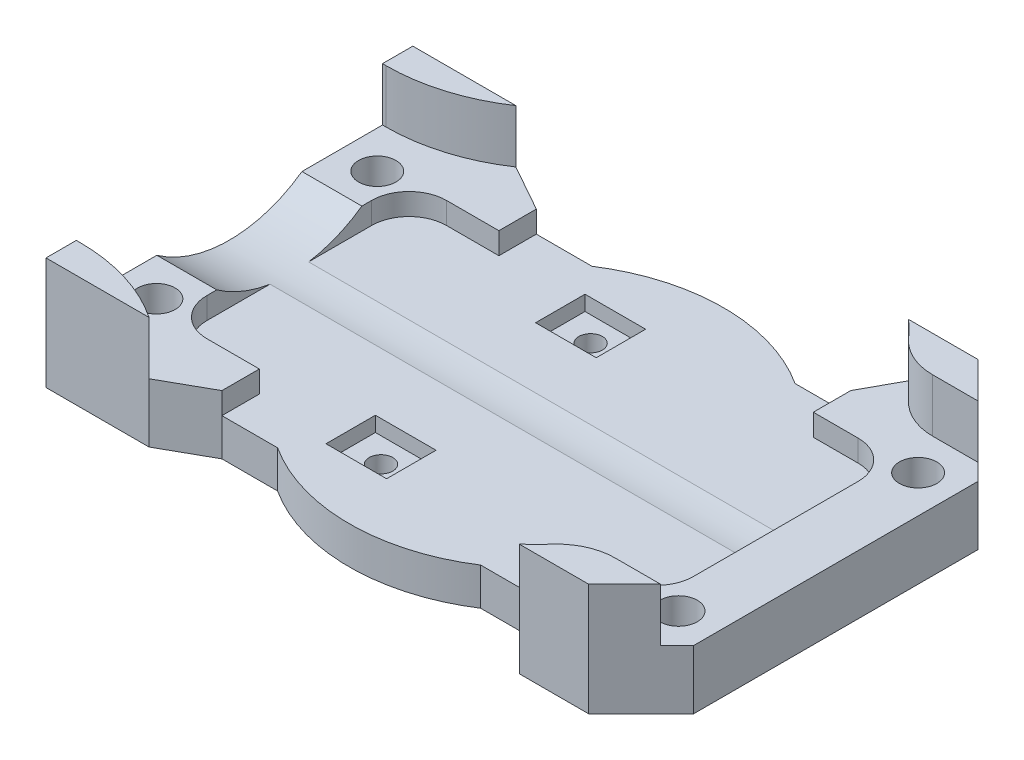
from build123d import *

# Parameters (mm, degrees)
SKETCH_1_R          = 25
SKETCH_1_W          = 81
SKETCH_1_H          = 42
SKETCH_1_R_2        = 2.5
EXTRUDE_1_DEPTH     = 5
SKETCH_3_W          = 8.1
SKETCH_3_H          = 6.6
SKETCH_3_R          = 1.575
CUT_EXTRUDE_1_DEPTH = 2
SKETCH_3_2_R        = 1.575
CUT_EXTRUDE_2_DEPTH = 49.280430818
SKETCH_4_W          = 8
SKETCH_4_H          = 2.9
EXTRUDE_2_DEPTH     = 42
SKETCH_1_3_R        = 2.5
CUT_EXTRUDE_3_DEPTH = 42
EXTRUDE_START       = 21
SKETCH_5_W          = 11
SKETCH_5_H          = 2.9
EXTRUDE_3_DEPTH     = 5
SKETCH_5_W_2        = 12
EXTRUDE_3_2_DEPTH   = 5
CUT_EXTRUDE_4_REACH = 87.138
CHAMFER_1_SIZE      = 2
EXTRUDE_4_DEPTH     = 15
EXTRUDE_4_2_DEPTH   = 15
EXTRUDE_START_2     = -15
EXTRUDE_5_DEPTH     = 7.9
EXTRUDE_6_DEPTH     = 15
EXTRUDE_7_DEPTH     = 7.9
FILLET_1_R          = 5


# Read off the part's stored shape, not the designer's step: 凸台-拉伸7
with BuildPart() as part:
    # 草图1 → 凸台-拉伸1 (new body)
    # profile 1 of 2: a face of its own
    with BuildSketch(Plane(origin=(0, 0, 0), x_dir=(1, 0, 0), z_dir=(0, 1, 0))):
        Circle(SKETCH_1_R)
    # profile 2 of 2: a face of its own
    with BuildSketch(Plane(origin=(0, 0, 0), x_dir=(1, 0, 0), z_dir=(0, 1, 0))):
        with Locations((-0.5, 0)):
            Rectangle(SKETCH_1_W, SKETCH_1_H)
        with Locations(Location((35, 16, 0), (0, 0, 270))):
            Circle(SKETCH_1_R_2, mode=Mode.SUBTRACT)
        with Locations(Location((35, -16, 0), (0, 0, 270))):
            Circle(SKETCH_1_R_2, mode=Mode.SUBTRACT)
        with Locations(Location((-36, 14.75, 0), (0, 0, 270))):
            Circle(SKETCH_1_R_2, mode=Mode.SUBTRACT)
        with Locations(Location((-36, -14.75, 0), (0, 0, 270))):
            Circle(SKETCH_1_R_2, mode=Mode.SUBTRACT)
    extrude(amount=EXTRUDE_1_DEPTH)

    # 草图3 → 切除-拉伸1 (cut)
    # profile 1 of 2: a face of its own
    with BuildSketch(Plane(origin=(0, 5, 0), x_dir=(1, 0, 0), z_dir=(0, 1, 0))):
        with Locations((-6.75, -14)):
            Rectangle(SKETCH_3_W, SKETCH_3_H)
        with Locations(Location((-6.75, -14, 0), (0, 0, 90))):
            Circle(SKETCH_3_R, mode=Mode.SUBTRACT)
    # profile 2 of 2: a face of its own
    with BuildSketch(Plane(origin=(0, 5, 0), x_dir=(1, 0, 0), z_dir=(0, 1, 0))):
        with Locations((-6.75, 14)):
            Rectangle(SKETCH_3_W, SKETCH_3_H)
        with Locations(Location((-6.75, 14, 0), (0, 0, 270))):
            Circle(SKETCH_3_R, mode=Mode.SUBTRACT)
    extrude(amount=-CUT_EXTRUDE_1_DEPTH, mode=Mode.SUBTRACT)

    # 草图3<2> → 切除-拉伸2 (cut, through all)
    with BuildSketch(Plane(origin=(0, 5, 0), x_dir=(1, 0, 0), z_dir=(0, 1, 0))):
        with Locations(Location((-6.75, 14, 0), (0, 0, 270))):
            Circle(SKETCH_3_2_R)
        with Locations(Location((-6.75, -14, 0), (0, 0, 270))):
            Circle(SKETCH_3_2_R)
    extrude(amount=-CUT_EXTRUDE_2_DEPTH, mode=Mode.SUBTRACT)

    # 草图4 → 凸台-拉伸2 (add)
    with BuildSketch(Plane.XY.offset(21)):
        with Locations((36, 6.45)):
            Rectangle(SKETCH_4_W, SKETCH_4_H)
        with Locations((-37, 6.45)):
            Rectangle(SKETCH_4_W, SKETCH_4_H)
    extrude(amount=-EXTRUDE_2_DEPTH)

    # 草图1<3> → 切除-拉伸3 (cut)
    with BuildSketch(Plane(origin=(0, 0, 0), x_dir=(1, 0, 0), z_dir=(0, 1, 0))):
        with Locations(Location((35, 16, 0), (0, 0, 270))):
            Circle(SKETCH_1_3_R)
        with Locations(Location((35, -16, 0), (0, 0, 270))):
            Circle(SKETCH_1_3_R)
        with Locations(Location((-36, 14.75, 0), (0, 0, 180))):
            Circle(SKETCH_1_3_R)
        with Locations(Location((-36, -14.75, 0), (0, 0, 180))):
            Circle(SKETCH_1_3_R)
    extrude(amount=CUT_EXTRUDE_3_DEPTH, mode=Mode.SUBTRACT)


with BuildPart() as body_2:
    # 草图5 → 凸台-拉伸3 (new body)
    with BuildSketch(Plane.XY.offset(EXTRUDE_START)):
        with Locations((26.5, 6.45)):
            Rectangle(SKETCH_5_W, SKETCH_5_H)
    extrude_3 = extrude(amount=-EXTRUDE_3_DEPTH)


with BuildPart() as body_3:
    # 草图5 → Extrude 3 2 (new body)
    with BuildSketch(Plane.XY.offset(EXTRUDE_START)):
        with Locations((-27, 6.45)):
            Rectangle(SKETCH_5_W_2, SKETCH_5_H)
    extrude_3_2 = extrude(amount=-EXTRUDE_3_2_DEPTH)



with BuildPart() as part_1:
    add(part.part)

    # 镜向2: 凸台-拉伸3, Extrude 3 2 across plane
    add(extrude_3.mirror(Plane(origin=(0, 0, 0), x_dir=(1, 0, 0), z_dir=(0, 0, -1))))
    add(extrude_3_2.mirror(Plane(origin=(0, 0, 0), x_dir=(1, 0, 0), z_dir=(0, 0, -1))))

    # 切除-拉伸4: up to this face of the body (flat: up to its plane)
    cut_extrude_4_end = Plane(part_1.part.faces().sort_by_distance((32, 6.45, 2.5))[0])
    # 草图6 → 切除-拉伸4 (cut, up to the picked face)
    with BuildSketch(Plane.ZY.offset(41), mode=Mode.PRIVATE) as cut_extrude_4_sk1:
        with BuildLine():
            Line((11.041960784, 8.971428571), (-11.041960784, 8.971428571))
            ThreePointArc((-11.041960784, 8.971428571), (-8.690257734, 7.239234925), (-6.072727273, 5.943265655))
            ThreePointArc((-6.072727273, 5.943265655), (0, 4.8), (6.072727273, 5.943265655))
            ThreePointArc((6.072727273, 5.943265655), (8.690257734, 7.239234925), (11.041960784, 8.971428571))
        make_face()
    cut_extrude_4_tool1 = split(extrude(cut_extrude_4_sk1.sketch, amount=-CUT_EXTRUDE_4_REACH, mode=Mode.PRIVATE), bisect_by=cut_extrude_4_end, keep=Keep.BOTH, mode=Mode.PRIVATE)
    add(cut_extrude_4_tool1.solids().sort_by(Axis((-41, 7.283597, 0), (1, 0, 0)))[0], mode=Mode.SUBTRACT)

    # 倒角1
    chamfer_1_edges = [part_1.edges().sort_by_distance(p)[0] for p in [
        (-41, 3.95, 21),
        (-41, 3.95, -21),
        (40, 3.95, -21),
        (40, 3.95, 21),
    ]]
    chamfer(chamfer_1_edges, length=CHAMFER_1_SIZE)



with BuildPart() as body_4:
    # 草图9 → 凸台-拉伸4 (new body)
    with BuildSketch(Plane.XZ):
        with BuildLine():
            Line((33, 26), (23.72846392, 26))
            ThreePointArc((23.72846392, 26), (24.88485791, 24.895458357), (25.989891949, 23.739534884))
            ThreePointArc((25.989891949, 23.739534884), (27.687521221, 22.340851231), (29.708138181, 21.471732017))
            ThreePointArc((29.708138181, 21.471732017), (30.719571772, 21.268231436), (31.749015733, 21.2))
            Line((31.749015733, 21.2), (37.8, 21.2))
            Line((37.8, 21.2), (33, 26))
        make_face()
    extrude(amount=-EXTRUDE_4_DEPTH)


with BuildPart() as body_5:
    # 草图9 → Extrude 4 2 (new body)
    with BuildSketch(Plane.XZ):
        with BuildLine():
            Line((33, -26), (37.8, -21.2))
            Line((37.8, -21.2), (31.749015733, -21.2))
            ThreePointArc((31.749015733, -21.2), (30.719571772, -21.268231436), (29.708138181, -21.471732017))
            ThreePointArc((29.708138181, -21.471732017), (27.687521221, -22.340851231), (25.989891949, -23.739534884))
            ThreePointArc((25.989891949, -23.739534884), (24.88485791, -24.895458357), (23.72846392, -26))
            Line((23.72846392, -26), (33, -26))
        make_face()
    extrude(amount=-EXTRUDE_4_2_DEPTH)


with BuildPart() as part_2:
    add(part_1.part)

    add(body_4.part)  # 凸台-拉伸5 merges body 4
    # 草图10 → 凸台-拉伸5 (add)
    with BuildSketch(Plane(origin=(0, 15, 0), x_dir=(1, 0, 0), z_dir=(0, 1, 0)).offset(EXTRUDE_START_2)):
        with BuildLine():
            Line((21, -21), (23.72846392, -26))
            ThreePointArc((23.72846392, -26), (24.88485791, -24.895458357), (25.989891949, -23.739534884))
            ThreePointArc((25.989891949, -23.739534884), (28.601924052, -21.863066908), (31.749015733, -21.2))
            Line((31.749015733, -21.2), (37.8, -21.2))
            Line((37.8, -21.2), (38, -21))
            Line((38, -21), (32, -21))
            Line((32, -21), (21, -21))
        make_face()
    extrude_5 = extrude(amount=EXTRUDE_5_DEPTH)


with BuildPart() as body_3_1:
    add(body_3.part)

    add(part_2.part)  # 凸台-拉伸6 merges part
    # 草图11 → 凸台-拉伸6 (add)
    with BuildSketch(Plane.XZ.offset(EXTRUDE_START_2)):
        with BuildLine():
            Line((-41, 23), (-41, 20.45))
            Line((-41, 20.45), (-40.520827978, 20.45))
            ThreePointArc((-40.520827978, 20.45), (-40.024975712, 20.455165886), (-39.5293387, 20.4706613))
            Line((-39.5293387, 20.4706613), (-39, 21))
            Line((-39, 21), (-35.43383476, 21))
            ThreePointArc((-35.43383476, 21), (-31.171725667, 22.363148102), (-27.240108871, 24.5))
            Line((-27.240108871, 24.5), (-41, 24.5))
            Line((-41, 24.5), (-41, 23))
        make_face()
        with BuildLine():
            Line((-39, 21), (-39.5293387, 20.4706613))
            ThreePointArc((-39.5293387, 20.4706613), (-39.301113021, 20.481274846), (-39.072999743, 20.494078772))
            ThreePointArc((-39.072999743, 20.494078772), (-38.358018151, 20.54847571), (-37.644999743, 20.624386527))
            ThreePointArc((-37.644999743, 20.624386527), (-36.534990206, 20.786132091), (-35.43383476, 21))
            Line((-35.43383476, 21), (-39, 21))
        make_face()
    extrude_6 = extrude(amount=EXTRUDE_6_DEPTH)

    # 凸台-拉伸7 outline → 凸台-拉伸7 (add)
    with BuildSketch(Plane(origin=(0, 0, 0), x_dir=(1, 0, 0), z_dir=(0, 1, 0))):
        with BuildLine():
            Line((-39.5293387, -20.4706613), (-41, -19))
            Line((-41, -19), (-41, -20.45))
            Line((-41, -20.45), (-40.520827978, -20.45))
            ThreePointArc((-40.520827978, -20.45), (-40.024975712, -20.455165886), (-39.5293387, -20.4706613))
        make_face()
        with BuildLine():
            Line((-21, -21), (-35.43383476, -21))
            ThreePointArc((-35.43383476, -21), (-31.171725667, -22.363148102), (-27.240108871, -24.5))
            Line((-27.240108871, -24.5), (-21, -21))
        make_face()
    extrude_7 = extrude(amount=EXTRUDE_7_DEPTH)

    # 镜向3: 凸台-拉伸5, 凸台-拉伸6, 凸台-拉伸7 across plane
    add(extrude_5.mirror(Plane(origin=(0, 0, 0), x_dir=(1, 0, 0), z_dir=(0, 0, -1))))
    add(extrude_6.mirror(Plane(origin=(0, 0, 0), x_dir=(1, 0, 0), z_dir=(0, 0, -1))))
    add(extrude_7.mirror(Plane(origin=(0, 0, 0), x_dir=(1, 0, 0), z_dir=(0, 0, -1))))


with BuildPart() as body_2_1:
    add(body_2.part)

    # Combine 1: union body 3, body 5
    add(body_3_1.part)
    add(body_5.part)

    # 圆角1
    fillet_1_edges = [body_2_1.edges().sort_by_distance(p)[0] for p in [
        (32, 6.45, 16),
        (-33, 6.45, 16),
        (-33, 6.45, -16),
        (32, 6.45, -16),
    ]]
    fillet(fillet_1_edges, radius=FILLET_1_R)


solid = body_2_1.part
